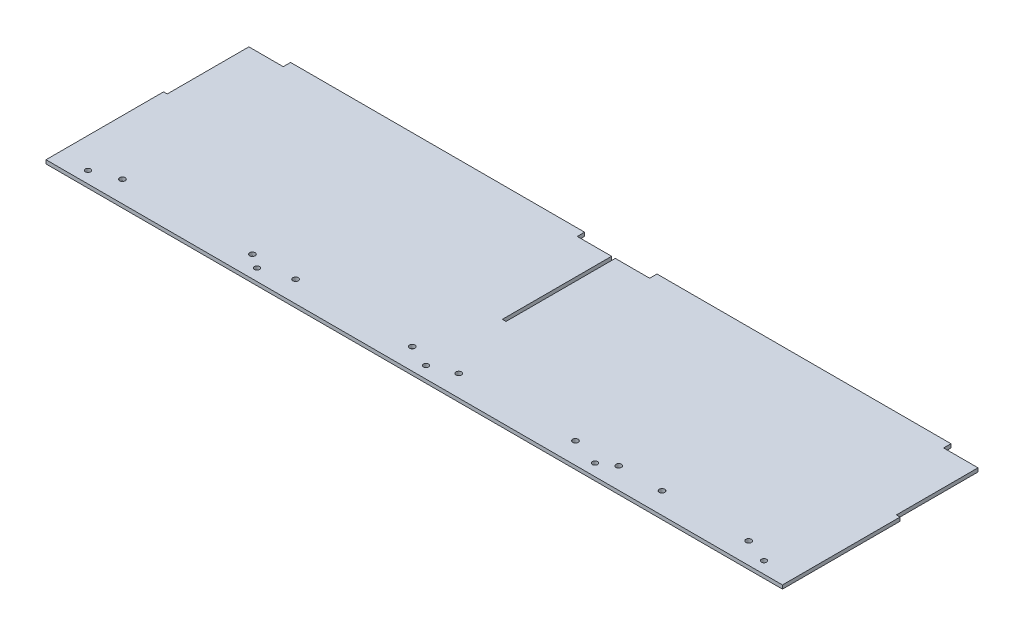
from build123d import *

# Parameters (mm, degrees)
SKETCH1_W            = 629.90984
SKETCH1_H            = 147.69846
BOSS_EXTRUDE1_DEPTH  = 3.175
SKETCH3_W            = 254
SKETCH3_H            = 3.175
BOSS_EXTRUDE2_DEPTH  = 6.35
SKETCH4_W            = 3.175
SKETCH4_H            = 188.732840052
CUT_EXTRUDE1_DEPTH   = 3.175
SKETCH9_W            = 3.175
SKETCH9_H            = 77.20584
BOSS_EXTRUDE4_DEPTH  = 3.175
SKETCH10_W           = 636.25984
SKETCH10_H           = 24.39416
BOSS_EXTRUDE5_DEPTH  = 3.175
SKETCH13_R           = 2.25
CUT_EXTRUDE3_DEPTH   = 652.56536379
M4_CLEARANCE_HOLE1_D = 4.8


with BuildPart() as part:
    # Sketch1 → Boss-Extrude1 (new body)
    with BuildSketch(Plane(origin=(0, 0, 0), x_dir=(1, 0, 0), z_dir=(0, 1, 0))):
        with Locations((314.95492, 73.84923)):
            Rectangle(SKETCH1_W, SKETCH1_H)
    extrude(amount=BOSS_EXTRUDE1_DEPTH)

    # Sketch3 → Boss-Extrude2 (add)
    with BuildSketch(Plane(origin=(0, 0, -147.69846), x_dir=(-1, 0, 0), z_dir=(0, 0, -1))):
        with Locations((-473.22613, 1.5875)):
            Rectangle(SKETCH3_W, SKETCH3_H)
        with Locations((-156.68371, 1.5875)):
            Rectangle(SKETCH3_W, SKETCH3_H)
    extrude(amount=BOSS_EXTRUDE2_DEPTH)

    # Sketch4 → Cut-Extrude1 (cut)
    with BuildSketch(Plane(origin=(0, 3.175, 0), x_dir=(1, 0, 0), z_dir=(0, 1, 0))):
        with Locations((314.95492, 147.69846)):
            Rectangle(SKETCH4_W, SKETCH4_H)
    extrude(amount=-CUT_EXTRUDE1_DEPTH, mode=Mode.SUBTRACT)

    # Sketch9 → Boss-Extrude4 (add, through all)
    with BuildSketch(Plane.XZ):
        with Locations((-1.5875, -38.60292)):
            Rectangle(SKETCH9_W, SKETCH9_H)
        with Locations((631.49734, -38.60292)):
            Rectangle(SKETCH9_W, SKETCH9_H)
    extrude(amount=-BOSS_EXTRUDE4_DEPTH)

    # Sketch10 → Boss-Extrude5 (add, through all)
    with BuildSketch(Plane(origin=(0, 3.175, 0), x_dir=(1, 0, 0), z_dir=(0, 1, 0))):
        with Locations((314.95492, -12.19708)):
            Rectangle(SKETCH10_W, SKETCH10_H)
    extrude(amount=-BOSS_EXTRUDE5_DEPTH)

    # Sketch13 → Cut-Extrude3 (cut, through all)
    with BuildSketch(Plane(origin=(0, 3.175, 0), x_dir=(1, 0, 0), z_dir=(0, 1, 0))):
        with Locations(Location((606.977733219, -14.23416, 0), (0, 0, 270))):
            Circle(SKETCH13_R)
        with Locations(Location((460.966326609, -14.23416, 0), (0, 0, 270))):
            Circle(SKETCH13_R)
        with Locations(Location((314.95492, -14.23416, 0), (0, 0, 270))):
            Circle(SKETCH13_R)
        with Locations(Location((168.943513391, -14.23416, 0), (0, 0, 270))):
            Circle(SKETCH13_R)
        with Locations(Location((22.932106781, -14.23416, 0), (0, 0, 270))):
            Circle(SKETCH13_R)
    extrude(amount=-CUT_EXTRUDE3_DEPTH, mode=Mode.SUBTRACT)

    # M4 Clearance Hole1 (through all)
    with Locations(Plane(origin=(0, 3.175, 0), x_dir=(1, 0, 0), z_dir=(0, 1, 0))):
        with Locations((44.409412743, -5.996840051), (156.68371, -5.996840051), (194.108475752, -5.996840051), (294.859886505, -5.996840051), (335.049953495, -5.996840051), (435.801364248, -5.996840051), (473.22613, -5.996840051), (510.650895752, -5.996840051), (585.500427257, -5.996840051)):
            Hole(M4_CLEARANCE_HOLE1_D / 2)


solid = part.part
